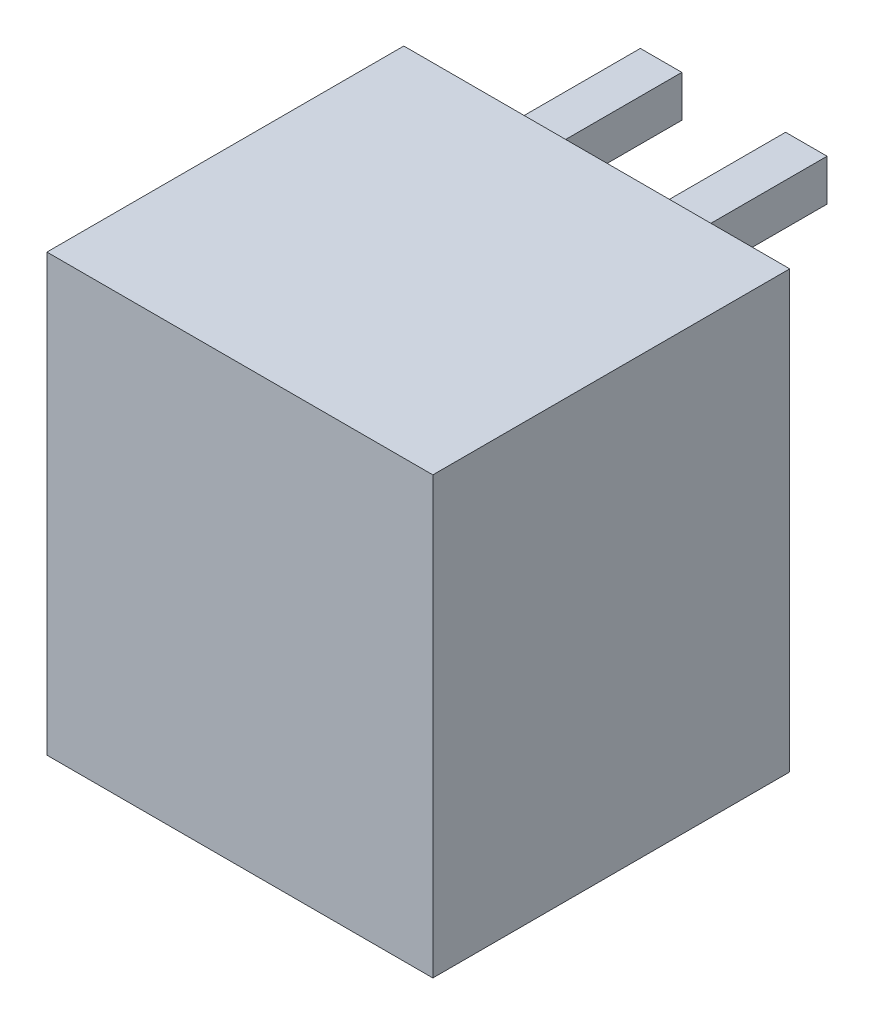
from build123d import *

# Parameters (mm, degrees)
SKETCH_1_W                         = 9.3
SKETCH_1_H                         = 10.5
EXTRUDE_1_DEPTH                    = 8.6
CUT_EXTRUDE_1_DEPTH                = 7
EXTRUDE_START                      = -5
SKETCH_3_W                         = 1
SKETCH_3_H                         = 1
EXTRUDE_2_DEPTH                    = 8.6
CHAMFER_1_SIZE                     = 0.3
SKETCH_4_W                         = 1
SKETCH_4_H                         = 1
EXTRUDE_3_DEPTH                    = 5
PATTERN_LINEAR_1_COUNT             = 2
PATTERN_LINEAR_1_PITCH             = 3.5
CHAMFER_1_OF_PATTERN_LINEAR_1_SIZE = 0.3


with BuildPart() as part:
    # Эскиз1 → Бобышка-Вытянуть1 (new body)
    with BuildSketch(Plane.XY):
        with Locations((0, 5.25)):
            Rectangle(SKETCH_1_W, SKETCH_1_H)
    extrude(amount=EXTRUDE_1_DEPTH)

    # Эскиз2 → Вырез-Вытянуть1 (cut)
    with BuildSketch(Plane.XZ):
        Polygon((-3.65, 6.6), (3.65, 6.6), (3.65, 0.2), (1.45, 0.2), (1.45, 1.8), (0.15, 1.8), (0.15, 0.2), (-2.05, 0.2), (-2.05, 1.8), (-3.65, 1.8), align=None)
    extrude(amount=-CUT_EXTRUDE_1_DEPTH, mode=Mode.SUBTRACT)

    # Эскиз3 → Бобышка-Вытянуть2 (add)
    with BuildSketch(Plane(origin=(0, 0, 0), x_dir=(-1, 0, 0), z_dir=(0, 0, -1)).offset(EXTRUDE_START)):
        with Locations((1.75, 9.5)):
            Rectangle(SKETCH_3_W, SKETCH_3_H)
    extrude_2 = extrude(amount=EXTRUDE_2_DEPTH)

    # Фаска1
    chamfer_1_edges = [part.edges().sort_by_distance(p)[0] for p in [
        (-1.25, 9.5, -3.6),
        (-1.75, 9, -3.6),
        (-2.25, 9.5, -3.6),
        (-1.75, 10, -3.6),
    ]]
    chamfer(chamfer_1_edges, length=CHAMFER_1_SIZE)

    # Эскиз4 → Бобышка-Вытянуть3 (add)
    with BuildSketch(Plane.XZ.offset(-7)):
        with Locations((-1.75, 4.35)):
            Rectangle(SKETCH_4_W, SKETCH_4_H)
    extrude_3 = extrude(amount=EXTRUDE_3_DEPTH)

    # Линейный массив1: Бобышка-Вытянуть2, Бобышка-Вытянуть3 ×2
    with Locations(*[(i * PATTERN_LINEAR_1_PITCH, 0, 0) for i in range(1, PATTERN_LINEAR_1_COUNT)]):
        add(extrude_2)
        add(extrude_3)

    # Фаска1 of Линейный массив1
    chamfer_1_of_pattern_linear_1_edges = [part.edges().sort_by_distance(p)[0] for p in [
        (2.25, 9.5, -3.6),
        (1.75, 9, -3.6),
        (1.25, 9.5, -3.6),
        (1.75, 10, -3.6),
    ]]
    chamfer(chamfer_1_of_pattern_linear_1_edges, length=CHAMFER_1_OF_PATTERN_LINEAR_1_SIZE)


solid = part.part
